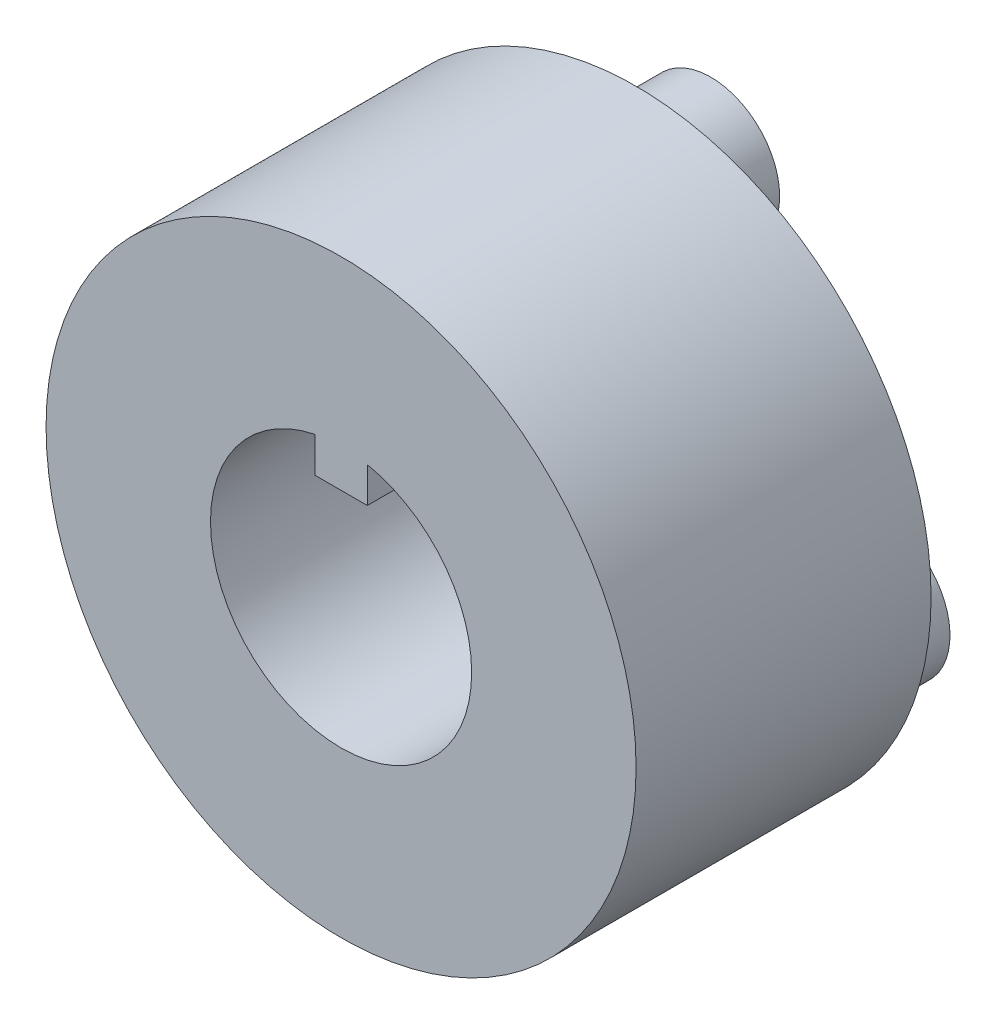
from build123d import *

# Parameters (mm, degrees)
GEARFACEPROFILE_R        = 15
GEARFACEEXTRUDE_DEPTH    = 15
CENTERSLOT_DEPTH         = 26.980762114
GEARCONNECTORS_OUTLINE_R = 3.5
GEARCONNECTORS_DEPTH     = 3.8


# Read off the part's stored shape, not the designer's step: GearConnectors
with BuildPart() as part:
    # GearFaceProfile → GearFaceExtrude (new body)
    with BuildSketch(Plane.XY):
        Circle(GEARFACEPROFILE_R)
    extrude(amount=GEARFACEEXTRUDE_DEPTH)

    # Sketch1 → CenterSlot (cut, through all)
    with BuildSketch(Plane.XY.offset(15)):
        with BuildLine():
            Line((-1.335, 6.504411964), (-1.335, 4.704411964))
            Line((-1.335, 4.704411964), (1.335, 4.704411964))
            Line((1.335, 4.704411964), (1.335, 6.504411964))
            ThreePointArc((1.335, 6.504411964), (0, -6.64), (-1.335, 6.504411964))
        make_face()
    extrude(amount=-CENTERSLOT_DEPTH, mode=Mode.SUBTRACT)

    # GearConnectors outline → GearConnectors (add)
    with BuildSketch(Plane(origin=(0, 0, 0), x_dir=(-1, 0, 0), z_dir=(0, 0, -1))):
        with BuildLine():
            ThreePointArc((5.310262334, -3.986315836), (11.691342952, -6.749999998), (6.107381948, -2.605664164))
            ThreePointArc((6.107381948, -2.605664164), (5.750408681, -3.32), (5.310262334, -3.986315836))
        make_face()
        with BuildLine():
            ThreePointArc((-6.107381948, -2.605664164), (-11.691342952, -6.749999998), (-5.310262334, -3.986315836))
            ThreePointArc((-5.310262334, -3.986315836), (-5.750408681, -3.32), (-6.107381948, -2.605664164))
        make_face()
        with Locations((0, 10)):
            Circle(GEARCONNECTORS_OUTLINE_R)
    extrude(amount=GEARCONNECTORS_DEPTH)


solid = part.part
